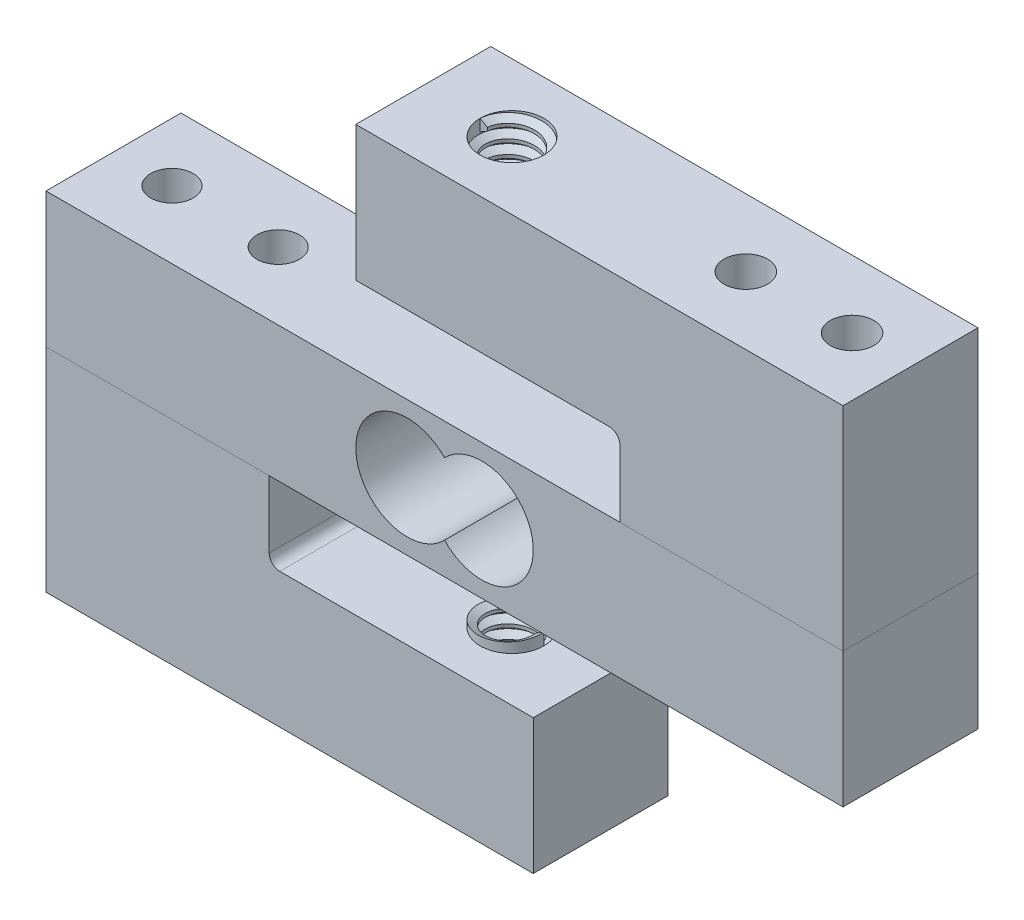
from build123d import *
from build123d.topology import SkipClean

# Parameters (mm, degrees)
SKETCH1_W           = 75
SKETCH1_H           = 12.7
SKETCH1_R           = 2
BOSS_EXTRUDE1_DEPTH = 12.7
SKETCH2_R           = 4.85
CUT_EXTRUDE1_DEPTH  = 12.7
SKETCH3_W           = 21
SKETCH3_H           = 12.7
SKETCH3_R           = 2.05
BOSS_EXTRUDE2_DEPTH = 20
SKETCH10_W          = 12.7
SKETCH10_H          = 12.7
BOSS_EXTRUDE3_DEPTH = 24.85
SKETCH11_R          = 3
CUT_EXTRUDE2_DEPTH  = 12.7
THREAD3_PITCH       = 1.27
FILLET1_R           = 1
CIRPATTERN2_COUNT   = 2


with BuildPart() as part:
    # Sketch1 → Boss-Extrude1 (new body)
    with BuildSketch(Plane(origin=(0, 0, 0), x_dir=(1, 0, 0), z_dir=(0, 1, 0))):
        Rectangle(SKETCH1_W, SKETCH1_H)
        with Locations(Location((-32, 0, 0), (0, 0, 270))):
            Circle(SKETCH1_R, mode=Mode.SUBTRACT)
        with Locations(Location((-22, 0, 0), (0, 0, 270))):
            Circle(SKETCH1_R, mode=Mode.SUBTRACT)
        with Locations(Location((22, 0, 0), (0, 0, 270))):
            Circle(SKETCH1_R, mode=Mode.SUBTRACT)
        with Locations(Location((32, 0, 0), (0, 0, 270))):
            Circle(SKETCH1_R, mode=Mode.SUBTRACT)
    extrude(amount=BOSS_EXTRUDE1_DEPTH)

    # Sketch2 → Cut-Extrude1 (cut)
    with BuildSketch(Plane.XY.offset(6.35)):
        with Locations((3.5, 6.35)):
            Circle(SKETCH2_R)
        with Locations((-3.5, 6.35)):
            Circle(SKETCH2_R)
    extrude(amount=-CUT_EXTRUDE1_DEPTH, mode=Mode.SUBTRACT)


with BuildPart() as body_2:
    # Sketch3 → Boss-Extrude2 (new body)
    with BuildSketch(Plane(origin=(0, 12.7, 0), x_dir=(1, 0, 0), z_dir=(0, 1, 0))):
        with Locations((27, 0)):
            Rectangle(SKETCH3_W, SKETCH3_H)
        with Locations(Location((32, 0, 0), (0, 0, 270))):
            Circle(SKETCH3_R, mode=Mode.SUBTRACT)
        with Locations(Location((22, 0, 0), (0, 0, 270))):
            Circle(SKETCH3_R, mode=Mode.SUBTRACT)
    extrude(amount=BOSS_EXTRUDE2_DEPTH)

    # Sketch10 → Boss-Extrude3 (add)
    with BuildSketch(Plane.ZY.offset(-16.5)):
        with Locations((0, 26.35)):
            Rectangle(SKETCH10_W, SKETCH10_H)
    extrude(amount=BOSS_EXTRUDE3_DEPTH)

    # Sketch11 → Cut-Extrude2 (cut)
    with BuildSketch(Plane(origin=(0, 32.7, 0), x_dir=(1, 0, 0), z_dir=(0, 1, 0))):
        with Locations(Location((0, 0, 0), (0, 0, 270))):
            Circle(SKETCH11_R)
    extrude(amount=-CUT_EXTRUDE2_DEPTH, mode=Mode.SUBTRACT)

    # Thread3: the profile of Thread Profile3 profile screwed along a right-hand helix of 10 turns, 8 arcs to a turn; built about Z, then put on its axis
    with SkipClean():  # the faces are left unmerged after this step: merging them gives an invalid solid
        thread3_z = Axis((0, 0, 0), (0, 0, 1))
        thread3_corners = [(3.0003, 0, -0.000173205), (3.0003, 0, 1.111423202), (2.312592339, 0, 0.714374998), (2.312592339, 0, 0.396874998)]
        with BuildLine(mode=Mode.PRIVATE) as thread3_profile:
            Line(thread3_corners[0], thread3_corners[1])
            Line(thread3_corners[1], thread3_corners[2])
            Line(thread3_corners[2], thread3_corners[3])
            Line(thread3_corners[3], thread3_corners[0])
        thread3_cap = Face(thread3_profile.wire())
        thread3_turn_angles = [0, 22.5, 45, 67.5, 90, 112.5, 135, 157.5, 180, 202.5, 225, 247.5, 270, 292.5, 315, 337.5, 360]
        thread3_turn_weights = [1, 0.9238795325112867, 1, 0.9238795325112867, 1, 0.9238795325112867, 1, 0.9238795325112867, 1, 0.9238795325112867, 1, 0.9238795325112867, 1, 0.9238795325112867, 1, 0.9238795325112867, 1]
        thread3_turn_rails = [Edge.make_bspline([Vector(p[0], p[1], 0).rotate(thread3_z, thread3_turn_angles[k]) / thread3_turn_weights[k] + Vector(0, 0, p[2] + THREAD3_PITCH * thread3_turn_angles[k] / 360) for k in range(17)], [0, 0, 0, 1, 1, 2, 2, 3, 3, 4, 4, 5, 5, 6, 6, 7, 7, 8, 8, 8], 2, thread3_turn_weights) for p in thread3_corners]
        thread3_turn_sides = [Face.make_surface_from_curves(thread3_turn_rails[p[0]], thread3_turn_rails[p[1]]) for p in [(0, 1), (1, 2), (2, 3), (3, 0)]]
        thread3 = Plane(origin=(0, 32.7, 0), x_dir=(-1, 0, 0), z_dir=(0, -1, 0)) * Solid(Shell([*[p.moved(Location((0, 0, THREAD3_PITCH * i))) for i in range(10) for p in thread3_turn_sides], thread3_cap, thread3_cap.rotate(thread3_z, 3600).moved(Location((0, 0, THREAD3_PITCH * 3600 / 360)))]))
        add(thread3)

    # Fillet1
    fillet1_edges = [body_2.edges().sort_by_distance(p)[0] for p in [
        (16.5, 20, 0),
    ]]
    fillet(fillet1_edges, radius=FILLET1_R)


with BuildPart() as cirpattern2_1:
    # CirPattern2: pattern copy
    add(body_2.part.rotate(Axis((0, 6.35, -6.985), (0, 0, 1)), 1 * 360 / CIRPATTERN2_COUNT))


solid = Compound([part.part, body_2.part, cirpattern2_1.part])
